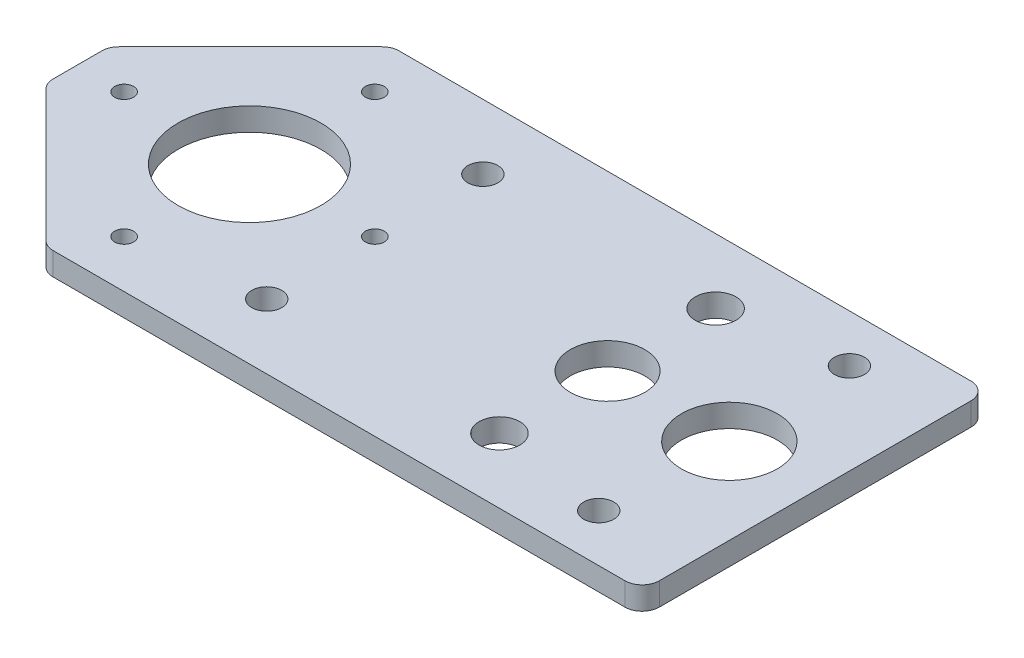
from build123d import *

# Parameters (mm, degrees)
SKETCH1_R           = 8.375
SKETCH1_R_2         = 3.56
SKETCH1_R_3         = 2.625
SKETCH1_R_4         = 12.5
SKETCH1_R_5         = 1.65
SKETCH1_R_6         = 6.5
BOSS_EXTRUDE1_DEPTH = 4


with BuildPart() as part:
    # Sketch1 → Boss-Extrude1 (new body)
    with BuildSketch(Plane.XZ):
        with BuildLine():
            Line((0, -27.25), (0, 27.25))
            ThreePointArc((0, 27.25), (-0.878679656, 29.371320344), (-3, 30.25))
            Line((-3, 30.25), (-103.008934219, 30.25))
            ThreePointArc((-103.008934219, 30.25), (-104.156984516, 30.021638598), (-105.130254562, 29.371320344))
            Line((-105.130254562, 29.371320344), (-128.121320344, 6.380254562))
            ThreePointArc((-128.121320344, 6.380254562), (-128.771638598, 5.406984516), (-129, 4.258934219))
            Line((-129, 4.258934219), (-129, -4.258934219))
            ThreePointArc((-129, -4.258934219), (-128.771638598, -5.406984516), (-128.121320344, -6.380254562))
            Line((-128.121320344, -6.380254562), (-105.130254562, -29.371320344))
            ThreePointArc((-105.130254562, -29.371320344), (-104.156984516, -30.021638598), (-103.008934219, -30.25))
            Line((-103.008934219, -30.25), (-3, -30.25))
            ThreePointArc((-3, -30.25), (-0.878679656, -29.371320344), (0, -27.25))
        make_face()
        with Locations((-15, 0)):
            Circle(SKETCH1_R, mode=Mode.SUBTRACT)
        with Locations((-36.3, 18.9)):
            Circle(SKETCH1_R_2, mode=Mode.SUBTRACT)
        with Locations((-77, 18.9)):
            Circle(SKETCH1_R_3, mode=Mode.SUBTRACT)
        with Locations((-36.3, -18.9)):
            Circle(SKETCH1_R_2, mode=Mode.SUBTRACT)
        with Locations((-77, -18.9)):
            Circle(SKETCH1_R_3, mode=Mode.SUBTRACT)
        with Locations((-98.920310217, 0)):
            Circle(SKETCH1_R_4, mode=Mode.SUBTRACT)
        with Locations((-77, 0)):
            Circle(SKETCH1_R_5, mode=Mode.SUBTRACT)
        with Locations((-120.840620434, 0)):
            Circle(SKETCH1_R_5, mode=Mode.SUBTRACT)
        with Locations((-98.920310217, -21.920310217)):
            Circle(SKETCH1_R_5, mode=Mode.SUBTRACT)
        with Locations((-98.920310217, 21.920310217)):
            Circle(SKETCH1_R_5, mode=Mode.SUBTRACT)
        with Locations((-15.92008574, 21.920310217)):
            Circle(SKETCH1_R_3, mode=Mode.SUBTRACT)
        with Locations((-15.92008574, -21.920310217)):
            Circle(SKETCH1_R_3, mode=Mode.SUBTRACT)
        with Locations((-36.3, 0)):
            Circle(SKETCH1_R_6, mode=Mode.SUBTRACT)
    extrude(amount=-BOSS_EXTRUDE1_DEPTH)


solid = part.part
